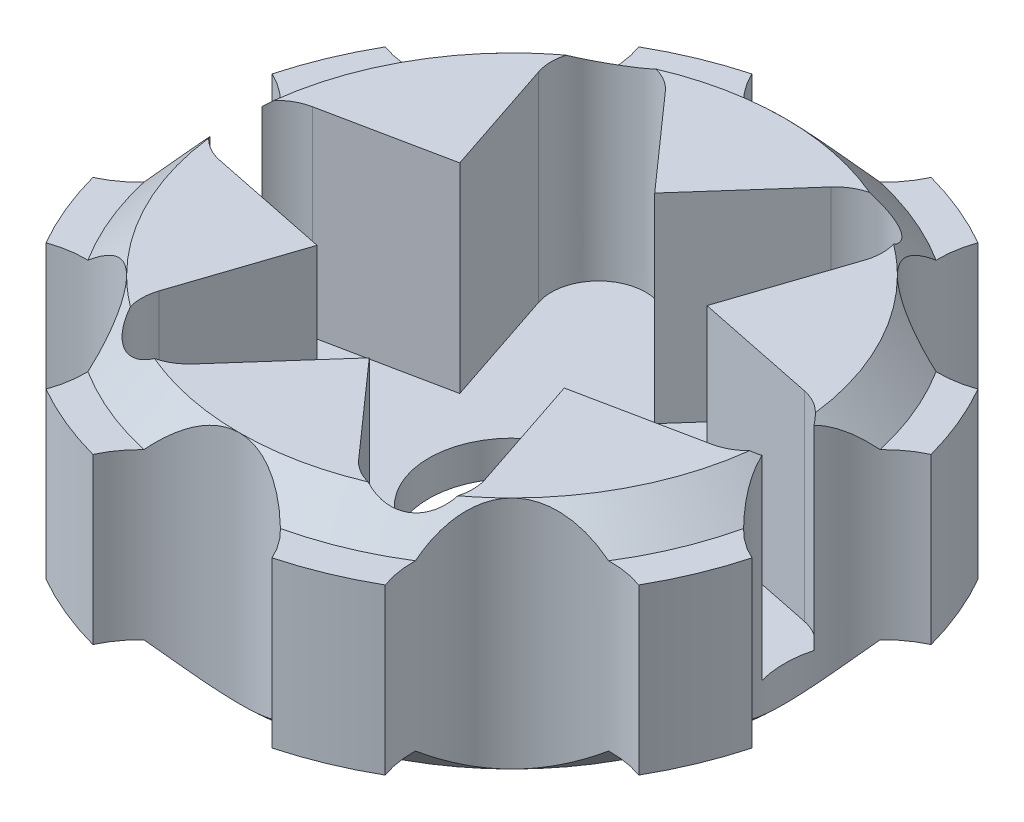
from build123d import *

# Parameters (mm, degrees)
SKETCH1_R           = 15.55551692
BOSS_EXTRUDE1_DEPTH = 9.4
BOSS_EXTRUDE2_START = 9.4
SKETCH1_4_R         = 15.55551692
BOSS_EXTRUDE2_DEPTH = 2
BOSS_EXTRUDE3_START = -2
SKETCH1_5_R         = 15.55551692
BOSS_EXTRUDE3_DEPTH = 2
CHAMFER2_SIZE       = 2
SKETCH3_R           = 6
SKETCH3_R_2         = 4.75
CUT_EXTRUDE4_DEPTH  = 11.4
SKETCH3_3_R         = 4.75
CUT_EXTRUDE5_DEPTH  = 30.783161882


with BuildPart() as part:
    # Sketch1 → Boss-Extrude1 (new body)
    with BuildSketch(Plane(origin=(0, 0, 0), x_dir=(1, 0, 0), z_dir=(0, 1, 0))):
        with BuildLine():
            ThreePointArc((-16.916819633, -9.681614935), (-13.766406033, -9.47966445), (-10.999411499, -10.999411499))
            ThreePointArc((-10.999411499, -10.999411499), (-14.371423694, -5.952838621), (-15.55551692, -3.1e-08))
            ThreePointArc((-15.55551692, -3.1e-08), (-16.437454083, -3.031184056), (-18.807933452, -5.116062305))
            ThreePointArc((-18.807933452, -5.116062305), (-18.007652913, -7.459014063), (-16.916819633, -9.681614935))
        make_face()
        with BuildLine():
            ThreePointArc((-5.116062305, -18.807933452), (-3.031184038, -16.437454071), (1.1e-08, -15.55551692))
            ThreePointArc((1.1e-08, -15.55551692), (-5.952838602, -14.371423702), (-10.999411499, -10.999411499))
            ThreePointArc((-10.999411499, -10.999411499), (-9.47966445, -13.766406033), (-9.681614935, -16.916819633))
            ThreePointArc((-9.681614935, -16.916819633), (-7.459014063, -18.007652913), (-5.116062305, -18.807933452))
        make_face()
        with BuildLine():
            ThreePointArc((1.1e-08, -15.55551692), (3.031184048, -16.437454078), (5.116062305, -18.807933452))
            ThreePointArc((5.116062305, -18.807933452), (7.459014063, -18.007652913), (9.681614935, -16.916819633))
            ThreePointArc((9.681614935, -16.916819633), (9.47966445, -13.766406033), (10.999411499, -10.999411499))
            ThreePointArc((10.999411499, -10.999411499), (5.952838612, -14.371423698), (1.1e-08, -15.55551692))
        make_face()
        Circle(SKETCH1_R)
        with BuildLine():
            ThreePointArc((15.55551692, 0), (14.3714237, -5.952838607), (10.999411499, -10.999411499))
            ThreePointArc((10.999411499, -10.999411499), (13.766406033, -9.47966445), (16.916819633, -9.681614935))
            ThreePointArc((16.916819633, -9.681614935), (18.007652913, -7.459014063), (18.807933452, -5.116062305))
            ThreePointArc((18.807933452, -5.116062305), (16.437454074, -3.031184043), (15.55551692, 0))
        make_face()
        with BuildLine():
            ThreePointArc((10.999411479, 10.999411519), (14.371423695, 5.95283862), (15.55551692, 0))
            ThreePointArc((15.55551692, 0), (16.437454074, 3.031184043), (18.807933452, 5.116062305))
            ThreePointArc((18.807933452, 5.116062305), (18.007652913, 7.459014063), (16.916819633, 9.681614935))
            ThreePointArc((16.916819633, 9.681614935), (13.76640602, 9.479664453), (10.999411479, 10.999411519))
        make_face()
        with BuildLine():
            ThreePointArc((-2e-09, 15.55551692), (5.952838593, 14.371423706), (10.999411479, 10.999411519))
            ThreePointArc((10.999411479, 10.999411519), (9.479664447, 13.766406047), (9.681614935, 16.916819633))
            ThreePointArc((9.681614935, 16.916819633), (7.459014063, 18.007652913), (5.116062305, 18.807933452))
            ThreePointArc((5.116062305, 18.807933452), (3.031184042, 16.437454074), (-2e-09, 15.55551692))
        make_face()
        with BuildLine():
            ThreePointArc((-9.681614935, 16.916819633), (-9.479664448, 13.766406042), (-10.999411487, 10.999411511))
            ThreePointArc((-10.999411487, 10.999411511), (-5.9528386, 14.371423703), (-2e-09, 15.55551692))
            ThreePointArc((-2e-09, 15.55551692), (-3.031184044, 16.437454075), (-5.116062305, 18.807933452))
            ThreePointArc((-5.116062305, 18.807933452), (-7.459014063, 18.007652913), (-9.681614935, 16.916819633))
        make_face()
        with BuildLine():
            ThreePointArc((-18.807933452, 5.116062305), (-16.437454066, 3.03118403), (-15.55551692, -3.1e-08))
            ThreePointArc((-15.55551692, -3.1e-08), (-14.371423703, 5.952838601), (-10.999411487, 10.999411511))
            ThreePointArc((-10.999411487, 10.999411511), (-13.766406025, 9.479664452), (-16.916819633, 9.681614935))
            ThreePointArc((-16.916819633, 9.681614935), (-18.007652913, 7.459014063), (-18.807933452, 5.116062305))
        make_face()
    extrude(amount=BOSS_EXTRUDE1_DEPTH)

    # Sketch1<4> → Boss-Extrude2 (add)
    with BuildSketch(Plane(origin=(0, 0, 0), x_dir=(1, 0, 0), z_dir=(0, 1, 0)).offset(BOSS_EXTRUDE2_START)):
        with Locations(Location((0, 0, 0), (0, 0, 270))):
            Circle(SKETCH1_4_R)
    extrude(amount=BOSS_EXTRUDE2_DEPTH)

    # Sketch1<5> → Boss-Extrude3 (add)
    with BuildSketch(Plane(origin=(0, 0, 0), x_dir=(1, 0, 0), z_dir=(0, 1, 0)).offset(BOSS_EXTRUDE3_START)):
        with Locations(Location((0, 0, 0), (0, 0, 270))):
            Circle(SKETCH1_5_R)
    extrude(amount=BOSS_EXTRUDE3_DEPTH)

    # Chamfer2
    # the kernel refuses this chamfer: 2 mm, written as the material it adds along each edge
    with BuildSketch(Plane(origin=(0, 9.4, 0), x_dir=(-0.7071067819532597, 0, 0.7071067804198353), z_dir=(-0.7071067804198353, 0, -0.7071067819532597))) as chamfer2_piece_1_section:
        Polygon((15.55551692, CHAMFER2_SIZE), (15.55551692 + CHAMFER2_SIZE, 0), (15.55551692, 0), align=None)
    chamfer2_piece_1 = revolve(axis=Axis((0, 9.4, 0), (0, 1, 0)), revolution_arc=45.000000062, mode=Mode.PRIVATE)
    chamfer2_piece_1 = chamfer2_piece_1 - Plane(origin=(-14.994564813, 10.103766753, 14.994564813), x_dir=(-0.3402220920568066, 0, -0.9403451111567975), z_dir=(0, -1, 0)) * Cylinder(5.65, 71, mode=Mode.PRIVATE)
    chamfer2_piece_1 = chamfer2_piece_1 - Plane(origin=(0, 10.103766753, 21.20551692), x_dir=(-0.9054977531574303, 0, -0.42435105635174936), z_dir=(0, -1, 0)) * Cylinder(5.65, 71, mode=Mode.PRIVATE)
    add(chamfer2_piece_1)
    with BuildSketch(Plane(origin=(0, 9.4, 0), x_dir=(-1.0, 0, 2.0490157005346928e-09), z_dir=(-2.0490157005346928e-09, 0, -1.0))) as chamfer2_piece_2_section:
        Polygon((15.55551692, CHAMFER2_SIZE), (15.55551692 + CHAMFER2_SIZE, 0), (15.55551692, 0), align=None)
    chamfer2_piece_2 = revolve(axis=Axis((0, 9.4, 0), (0, 1, 0)), revolution_arc=44.99999982, mode=Mode.PRIVATE)
    chamfer2_piece_2 = chamfer2_piece_2 - Plane(origin=(-21.20551692, 10.103766743, 0), x_dir=(1.0, 0, 5.4411098439037235e-09), z_dir=(0, -1, 0)) * Cylinder(5.65, 71, mode=Mode.PRIVATE)
    chamfer2_piece_2 = chamfer2_piece_2 - Plane(origin=(-14.994564813, 10.103766743, 14.994564813), x_dir=(-0.3402220920568066, 0, -0.9403451111567975), z_dir=(0, -1, 0)) * Cylinder(5.65, 71, mode=Mode.PRIVATE)
    add(chamfer2_piece_2)
    with BuildSketch(Plane(origin=(0, 9.4, 0), x_dir=(-0.7071067817625238, 0, -0.7071067806105713), z_dir=(0.7071067806105713, 0, -0.7071067817625238))) as chamfer2_piece_3_section:
        Polygon((15.55551692 + CHAMFER2_SIZE, 0), (15.55551692, CHAMFER2_SIZE), (15.55551692, 0), align=None)
    chamfer2_piece_3 = revolve(axis=Axis((0, 9.4, 0), (0, 1, 0)), revolution_arc=45.000000071, mode=Mode.PRIVATE)
    chamfer2_piece_3 = chamfer2_piece_3 - Plane(origin=(-14.994564813, 10.103766886, -14.994564813), x_dir=(0.9403451111567979, 0, -0.34022209205680554), z_dir=(0, -1, 0)) * Cylinder(5.65, 71, mode=Mode.PRIVATE)
    chamfer2_piece_3 = chamfer2_piece_3 - Plane(origin=(-21.20551692, 10.103766886, 0), x_dir=(1.0, 0, 5.4411098439037235e-09), z_dir=(0, -1, 0)) * Cylinder(5.65, 71, mode=Mode.PRIVATE)
    add(chamfer2_piece_3)
    with BuildSketch(Plane(origin=(0, 9.4, 0), x_dir=(1.1417875063861984e-10, 0, -1.0), z_dir=(1.0, 0, 1.1417875063861984e-10))) as chamfer2_piece_4_section:
        Polygon((15.55551692 + CHAMFER2_SIZE, 0), (15.55551692, CHAMFER2_SIZE), (15.55551692, 0), align=None)
    chamfer2_piece_4 = revolve(axis=Axis((0, 9.4, 0), (0, 1, 0)), revolution_arc=45.000000053, mode=Mode.PRIVATE)
    chamfer2_piece_4 = chamfer2_piece_4 - Plane(origin=(-14.994564813, 10.103766753, -14.994564813), x_dir=(0.9403451111567979, 0, -0.34022209205680554), z_dir=(0, -1, 0)) * Cylinder(5.65, 71, mode=Mode.PRIVATE)
    chamfer2_piece_4 = chamfer2_piece_4 - Plane(origin=(0, 10.103766753, -21.20551692), x_dir=(0.9054977531574306, 0, 0.4243510563517486), z_dir=(0, -1, 0)) * Cylinder(5.65, 71, mode=Mode.PRIVATE)
    add(chamfer2_piece_4)
    with BuildSketch(Plane(origin=(0, 9.4, 0), x_dir=(0.7071067822725222, 0, -0.7071067801005728), z_dir=(0.7071067801005728, 0, 0.7071067822725222))) as chamfer2_piece_5_section:
        Polygon((15.55551692, CHAMFER2_SIZE), (15.55551692 + CHAMFER2_SIZE, 0), (15.55551692, 0), align=None)
    chamfer2_piece_5 = revolve(axis=Axis((0, 9.4, 0), (0, 1, 0)), revolution_arc=45.000000081, mode=Mode.PRIVATE)
    chamfer2_piece_5 = chamfer2_piece_5 - Plane(origin=(0, 10.103766753, -21.20551692), x_dir=(0.9054977531574306, 0, 0.4243510563517486), z_dir=(0, -1, 0)) * Cylinder(5.65, 71, mode=Mode.PRIVATE)
    chamfer2_piece_5 = chamfer2_piece_5 - Plane(origin=(14.994564813, 10.103766753, -14.994564813), x_dir=(0.3402220920568063, 0, 0.9403451111567976), z_dir=(0, -1, 0)) * Cylinder(5.65, 71, mode=Mode.PRIVATE)
    add(chamfer2_piece_5)
    with BuildSketch(Plane(origin=(0, 9.4, 0), x_dir=(1.0, 0, 4.268254867465012e-10), z_dir=(-4.268254867465012e-10, 0, 1.0))) as chamfer2_piece_6_section:
        Polygon((15.55551692, CHAMFER2_SIZE), (15.55551692 + CHAMFER2_SIZE, 0), (15.55551692, 0), align=None)
    chamfer2_piece_6 = revolve(axis=Axis((0, 9.4, 0), (0, 1, 0)), revolution_arc=44.999999936, mode=Mode.PRIVATE)
    chamfer2_piece_6 = chamfer2_piece_6 - Plane(origin=(14.994564813, 10.103766753, -14.994564813), x_dir=(0.3402220920568063, 0, 0.9403451111567976), z_dir=(0, -1, 0)) * Cylinder(5.65, 71, mode=Mode.PRIVATE)
    chamfer2_piece_6 = chamfer2_piece_6 - Plane(origin=(21.20551692, 10.103766753, 0), x_dir=(-0.42435105635174664, 0, 0.9054977531574315), z_dir=(0, -1, 0)) * Cylinder(5.65, 71, mode=Mode.PRIVATE)
    add(chamfer2_piece_6)
    with BuildSketch(Plane(origin=(0, 9.4, 0), x_dir=(0.7071067799459831, 0, 0.7071067824271119), z_dir=(-0.7071067824271119, 0, 0.7071067799459831))) as chamfer2_piece_7_section:
        Polygon((15.55551692, CHAMFER2_SIZE), (15.55551692 + CHAMFER2_SIZE, 0), (15.55551692, 0), align=None)
    chamfer2_piece_7 = revolve(axis=Axis((0, 9.4, 0), (0, 1, 0)), revolution_arc=45.000000076, mode=Mode.PRIVATE)
    chamfer2_piece_7 = chamfer2_piece_7 - Plane(origin=(14.994564813, 10.103766753, 14.994564813), x_dir=(-0.9403451111567976, 0, 0.34022209205680604), z_dir=(0, -1, 0)) * Cylinder(5.65, 71, mode=Mode.PRIVATE)
    chamfer2_piece_7 = chamfer2_piece_7 - Plane(origin=(21.20551692, 10.103766753, 0), x_dir=(-0.42435105635174664, 0, 0.9054977531574315), z_dir=(0, -1, 0)) * Cylinder(5.65, 71, mode=Mode.PRIVATE)
    add(chamfer2_piece_7)
    with BuildSketch(Plane(origin=(0, 9.4, 0), x_dir=(0, 0, 1), z_dir=(-1, 0, 0))) as chamfer2_piece_8_section:
        Polygon((15.55551692, CHAMFER2_SIZE), (15.55551692 + CHAMFER2_SIZE, 0), (15.55551692, 0), align=None)
    chamfer2_piece_8 = revolve(axis=Axis((0, 9.4, 0), (0, 1, 0)), revolution_arc=44.999999899, mode=Mode.PRIVATE)
    chamfer2_piece_8 = chamfer2_piece_8 - Plane(origin=(14.994564813, 10.103766753, 14.994564813), x_dir=(-0.9403451111567976, 0, 0.34022209205680604), z_dir=(0, -1, 0)) * Cylinder(5.65, 71, mode=Mode.PRIVATE)
    chamfer2_piece_8 = chamfer2_piece_8 - Plane(origin=(0, 10.103766753, 21.20551692), x_dir=(-0.9054977531574303, 0, -0.42435105635174936), z_dir=(0, -1, 0)) * Cylinder(5.65, 71, mode=Mode.PRIVATE)
    add(chamfer2_piece_8)
    with BuildSketch(Plane(origin=(0, 0, 0), x_dir=(-0.7071067819532592, 0, 0.707106780419836), z_dir=(-0.707106780419836, 0, -0.7071067819532592))) as chamfer2_piece_9_section:
        Polygon((15.55551692, -CHAMFER2_SIZE), (15.55551692 + CHAMFER2_SIZE, 0), (15.55551692, 0), align=None)
    chamfer2_piece_9 = revolve(axis=Axis((0, 0, 0), (0, 1, 0)), revolution_arc=45.000000062, mode=Mode.PRIVATE)
    chamfer2_piece_9 = chamfer2_piece_9 - Plane(origin=(-14.994564813, -0.703766753, 14.994564813), x_dir=(-0.3402220920568066, 0, -0.9403451111567975), z_dir=(0, -1, 0)) * Cylinder(5.65, 71, mode=Mode.PRIVATE)
    chamfer2_piece_9 = chamfer2_piece_9 - Plane(origin=(0, -0.703766753, 21.20551692), x_dir=(-0.9054977531574303, 0, -0.42435105635174936), z_dir=(0, -1, 0)) * Cylinder(5.65, 71, mode=Mode.PRIVATE)
    add(chamfer2_piece_9)
    with BuildSketch(Plane(origin=(0, 0, 0), x_dir=(-1.0, 0, 7.725603147000415e-10), z_dir=(-7.725603147000415e-10, 0, -1.0))) as chamfer2_piece_10_section:
        Polygon((15.55551692, -CHAMFER2_SIZE), (15.55551692 + CHAMFER2_SIZE, 0), (15.55551692, 0), align=None)
    chamfer2_piece_10 = revolve(axis=Axis((0, 0, 0), (0, 1, 0)), revolution_arc=44.999999894, mode=Mode.PRIVATE)
    chamfer2_piece_10 = chamfer2_piece_10 - Plane(origin=(-21.20551692, -0.703766743, 0), x_dir=(1.0, 0, 5.4411098439037235e-09), z_dir=(0, -1, 0)) * Cylinder(5.65, 71, mode=Mode.PRIVATE)
    chamfer2_piece_10 = chamfer2_piece_10 - Plane(origin=(-14.994564813, -0.703766743, 14.994564813), x_dir=(-0.3402220920568066, 0, -0.9403451111567975), z_dir=(0, -1, 0)) * Cylinder(5.65, 71, mode=Mode.PRIVATE)
    add(chamfer2_piece_10)
    with BuildSketch(Plane(origin=(0, 0, 0), x_dir=(-0.7071067817031288, 0, -0.7071067806699662), z_dir=(0.7071067806699662, 0, -0.7071067817031288))) as chamfer2_piece_11_section:
        Polygon((15.55551692 + CHAMFER2_SIZE, 0), (15.55551692, -CHAMFER2_SIZE), (15.55551692, 0), align=None)
    chamfer2_piece_11 = revolve(axis=Axis((0, 0, 0), (0, 1, 0)), revolution_arc=45.000000002, mode=Mode.PRIVATE)
    chamfer2_piece_11 = chamfer2_piece_11 - Plane(origin=(-14.994564813, -0.703766886, -14.994564813), x_dir=(0.9403451111567979, 0, -0.34022209205680554), z_dir=(0, -1, 0)) * Cylinder(5.65, 71, mode=Mode.PRIVATE)
    chamfer2_piece_11 = chamfer2_piece_11 - Plane(origin=(-21.20551692, -0.703766886, 0), x_dir=(1.0, 0, 5.4411098439037235e-09), z_dir=(0, -1, 0)) * Cylinder(5.65, 71, mode=Mode.PRIVATE)
    add(chamfer2_piece_11)
    with BuildSketch(Plane(origin=(0, 0, 0), x_dir=(-5.915567194248534e-10, 0, -1.0), z_dir=(1.0, 0, -5.915567194248534e-10))) as chamfer2_piece_12_section:
        Polygon((15.55551692 + CHAMFER2_SIZE, 0), (15.55551692, -CHAMFER2_SIZE), (15.55551692, 0), align=None)
    chamfer2_piece_12 = revolve(axis=Axis((0, 0, 0), (0, 1, 0)), revolution_arc=45.000000008, mode=Mode.PRIVATE)
    chamfer2_piece_12 = chamfer2_piece_12 - Plane(origin=(-14.994564813, -0.703766753, -14.994564813), x_dir=(0.9403451111567979, 0, -0.34022209205680554), z_dir=(0, -1, 0)) * Cylinder(5.65, 71, mode=Mode.PRIVATE)
    chamfer2_piece_12 = chamfer2_piece_12 - Plane(origin=(0, -0.703766753, -21.20551692), x_dir=(0.9054977531574306, 0, 0.4243510563517486), z_dir=(0, -1, 0)) * Cylinder(5.65, 71, mode=Mode.PRIVATE)
    add(chamfer2_piece_12)
    with BuildSketch(Plane(origin=(0, 0, 0), x_dir=(0.7071067803065033, 0, -0.7071067820665917), z_dir=(0.7071067820665917, 0, 0.7071067803065033))) as chamfer2_piece_13_section:
        Polygon((15.55551692, -CHAMFER2_SIZE), (15.55551692 + CHAMFER2_SIZE, 0), (15.55551692, 0), align=None)
    chamfer2_piece_13 = revolve(axis=Axis((0, 0, 0), (0, 1, 0)), revolution_arc=44.999999963, mode=Mode.PRIVATE)
    chamfer2_piece_13 = chamfer2_piece_13 - Plane(origin=(0, -0.703766753, -21.20551692), x_dir=(0.9054977531574306, 0, 0.4243510563517486), z_dir=(0, -1, 0)) * Cylinder(5.65, 71, mode=Mode.PRIVATE)
    chamfer2_piece_13 = chamfer2_piece_13 - Plane(origin=(14.994564813, -0.703766753, -14.994564813), x_dir=(0.3402220920568063, 0, 0.9403451111567976), z_dir=(0, -1, 0)) * Cylinder(5.65, 71, mode=Mode.PRIVATE)
    add(chamfer2_piece_13)
    with BuildSketch(Plane(origin=(0, 0, 0), x_dir=(1.0, 0, 2.989517751270151e-10), z_dir=(-2.989517751270151e-10, 0, 1.0))) as chamfer2_piece_14_section:
        Polygon((15.55551692, -CHAMFER2_SIZE), (15.55551692 + CHAMFER2_SIZE, 0), (15.55551692, 0), align=None)
    chamfer2_piece_14 = revolve(axis=Axis((0, 0, 0), (0, 1, 0)), revolution_arc=45.000000088, mode=Mode.PRIVATE)
    chamfer2_piece_14 = chamfer2_piece_14 - Plane(origin=(14.994564813, -0.703766753, -14.994564813), x_dir=(0.3402220920568063, 0, 0.9403451111567976), z_dir=(0, -1, 0)) * Cylinder(5.65, 71, mode=Mode.PRIVATE)
    chamfer2_piece_14 = chamfer2_piece_14 - Plane(origin=(21.20551692, -0.703766753, 0), x_dir=(-0.42435105635174664, 0, 0.9054977531574315), z_dir=(0, -1, 0)) * Cylinder(5.65, 71, mode=Mode.PRIVATE)
    add(chamfer2_piece_14)
    with BuildSketch(Plane(origin=(0, 0, 0), x_dir=(0.7071067811865478, 0, 0.7071067811865472), z_dir=(-0.7071067811865472, 0, 0.7071067811865478))) as chamfer2_piece_15_section:
        Polygon((15.55551692, -CHAMFER2_SIZE), (15.55551692 + CHAMFER2_SIZE, 0), (15.55551692, 0), align=None)
    chamfer2_piece_15 = revolve(axis=Axis((0, 0, 0), (0, 1, 0)), revolution_arc=44.999999983, mode=Mode.PRIVATE)
    chamfer2_piece_15 = chamfer2_piece_15 - Plane(origin=(14.994564813, -0.703766753, 14.994564813), x_dir=(-0.9403451111567976, 0, 0.34022209205680604), z_dir=(0, -1, 0)) * Cylinder(5.65, 71, mode=Mode.PRIVATE)
    chamfer2_piece_15 = chamfer2_piece_15 - Plane(origin=(21.20551692, -0.703766753, 0), x_dir=(-0.42435105635174664, 0, 0.9054977531574315), z_dir=(0, -1, 0)) * Cylinder(5.65, 71, mode=Mode.PRIVATE)
    add(chamfer2_piece_15)
    with BuildSketch(Plane(origin=(0, 0, 0), x_dir=(0, 0, 1), z_dir=(-1, 0, 0))) as chamfer2_piece_16_section:
        Polygon((15.55551692, -CHAMFER2_SIZE), (15.55551692 + CHAMFER2_SIZE, 0), (15.55551692, 0), align=None)
    chamfer2_piece_16 = revolve(axis=Axis((0, 0, 0), (0, 1, 0)), revolution_arc=45, mode=Mode.PRIVATE)
    chamfer2_piece_16 = chamfer2_piece_16 - Plane(origin=(14.994564813, -0.703766753, 14.994564813), x_dir=(-0.9403451111567976, 0, 0.34022209205680604), z_dir=(0, -1, 0)) * Cylinder(5.65, 71, mode=Mode.PRIVATE)
    chamfer2_piece_16 = chamfer2_piece_16 - Plane(origin=(0, -0.703766753, 21.20551692), x_dir=(-0.9054977531574303, 0, -0.42435105635174936), z_dir=(0, -1, 0)) * Cylinder(5.65, 71, mode=Mode.PRIVATE)
    add(chamfer2_piece_16)

    # Sketch3 → Cut-Extrude4 (cut)
    with BuildSketch(Plane(origin=(0, 11.4, 0), x_dir=(1, 0, 0), z_dir=(0, 1, 0))):
        with BuildLine():
            Line((-9.121537298, -10.900260879), (-6.793934197, -3.922479738))
            Line((-6.793934197, -3.922479738), (-14.000671478, -2.449352582))
            ThreePointArc((-14.000671478, -2.449352582), (-14.823782137, -2.120754784), (-15.480522468, -1.525624709))
            ThreePointArc((-15.480522468, -1.525624709), (-15.46225454, -1.700820735), (-15.44200395, -1.875798672))
            ThreePointArc((-15.44200395, -1.875798672), (-14.799622784, -2.366639098), (-14.040725196, -2.645300789))
            Line((-14.040725196, -2.645300789), (-7.055057277, -4.073239218))
            Line((-7.055057277, -4.073239218), (-9.311260282, -10.836974313))
            ThreePointArc((-9.311260282, -10.836974313), (-9.449380972, -11.633529748), (-9.345491277, -12.43526837))
            ThreePointArc((-9.345491277, -12.43526837), (-9.204081234, -12.540294864), (-9.061490989, -12.643713367))
            ThreePointArc((-9.061490989, -12.643713367), (-9.248518587, -11.777394518), (-9.121537298, -10.900260879))
        make_face()
        with BuildLine():
            Line((-4.87913418, -13.349613461), (0, -7.844959475))
            Line((0, -7.844959475), (-1.912800834, -5.686931771))
            ThreePointArc((-1.912800834, -5.686931771), (-3, -5.196152423), (-3.968626967, -4.5))
            Line((-3.968626967, -4.5), (-6.793934197, -3.922479738))
            Line((-6.793934197, -3.922479738), (-9.121537298, -10.900260879))
            ThreePointArc((-9.121537298, -10.900260879), (-9.248518587, -11.777394518), (-9.061490989, -12.643713367))
            ThreePointArc((-9.061490989, -12.643713367), (-7.77775846, -13.471472822), (-6.41903148, -14.169338076))
            ThreePointArc((-6.41903148, -14.169338076), (-5.57526355, -13.898149303), (-4.87913418, -13.349613461))
        make_face()
        with BuildLine():
            ThreePointArc((-6.096512672, -14.311067042), (-6.258173306, -14.241115599), (-6.41903148, -14.169338076))
            ThreePointArc((-6.41903148, -14.169338076), (-8, -13.856406461), (-9.061490989, -12.643713367))
            ThreePointArc((-9.061490989, -12.643713367), (-9.204081234, -12.540294864), (-9.345491277, -12.43526837))
            ThreePointArc((-9.345491277, -12.43526837), (-8.1, -14.029611541), (-6.096512672, -14.311067042))
        make_face()
        with BuildLine():
            Line((4.87913418, -13.349613461), (0, -7.844959475))
            Line((0, -7.844959475), (-4.87913418, -13.349613461))
            ThreePointArc((-4.87913418, -13.349613461), (-5.57526355, -13.898149303), (-6.41903148, -14.169338076))
            ThreePointArc((-6.41903148, -14.169338076), (-6.258173306, -14.241115599), (-6.096512672, -14.311067042))
            ThreePointArc((-6.096512672, -14.311067042), (-5.350241811, -14.000168846), (-4.729464914, -13.482275101))
            Line((-4.729464914, -13.482275101), (0, -8.146478436))
            Line((0, -8.146478436), (4.729464914, -13.482275101))
            ThreePointArc((4.729464914, -13.482275101), (5.350241811, -14.000168846), (6.096512672, -14.311067042))
            ThreePointArc((6.096512672, -14.311067042), (6.258173306, -14.241115599), (6.41903148, -14.169338076))
            ThreePointArc((6.41903148, -14.169338076), (5.57526355, -13.898149303), (4.87913418, -13.349613461))
        make_face()
        with BuildLine():
            Line((6.793934197, -3.922479738), (3.968626967, -4.5))
            ThreePointArc((3.968626967, -4.5), (3, -5.196152423), (1.912800834, -5.686931771))
            Line((1.912800834, -5.686931771), (0, -7.844959475))
            Line((0, -7.844959475), (4.87913418, -13.349613461))
            ThreePointArc((4.87913418, -13.349613461), (5.57526355, -13.898149303), (6.41903148, -14.169338076))
            ThreePointArc((6.41903148, -14.169338076), (7.77775846, -13.471472822), (9.061490989, -12.643713367))
            ThreePointArc((9.061490989, -12.643713367), (9.248518587, -11.777394518), (9.121537298, -10.900260879))
            Line((9.121537298, -10.900260879), (6.793934197, -3.922479738))
        make_face()
        with BuildLine():
            ThreePointArc((9.345491277, -12.43526837), (9.204081234, -12.540294864), (9.061490989, -12.643713367))
            ThreePointArc((9.061490989, -12.643713367), (8, -13.856406461), (6.41903148, -14.169338076))
            ThreePointArc((6.41903148, -14.169338076), (6.258173306, -14.241115599), (6.096512672, -14.311067042))
            ThreePointArc((6.096512672, -14.311067042), (8.1, -14.029611541), (9.345491277, -12.43526837))
        make_face()
        with BuildLine():
            Line((14.000671478, -2.449352582), (6.793934197, -3.922479738))
            Line((6.793934197, -3.922479738), (9.121537298, -10.900260879))
            ThreePointArc((9.121537298, -10.900260879), (9.248518587, -11.777394518), (9.061490989, -12.643713367))
            ThreePointArc((9.061490989, -12.643713367), (9.204081234, -12.540294864), (9.345491277, -12.43526837))
            ThreePointArc((9.345491277, -12.43526837), (9.449380972, -11.633529748), (9.311260282, -10.836974313))
            Line((9.311260282, -10.836974313), (7.055057277, -4.073239218))
            Line((7.055057277, -4.073239218), (14.040725196, -2.645300789))
            ThreePointArc((14.040725196, -2.645300789), (14.799622784, -2.366639098), (15.44200395, -1.875798672))
            ThreePointArc((15.44200395, -1.875798672), (15.46225454, -1.700820735), (15.480522468, -1.525624709))
            ThreePointArc((15.480522468, -1.525624709), (14.823782137, -2.120754784), (14.000671478, -2.449352582))
        make_face()
        with BuildLine():
            ThreePointArc((6.41903148, -14.169338076), (8, -13.856406461), (9.061490989, -12.643713367))
            ThreePointArc((9.061490989, -12.643713367), (7.77775846, -13.471472822), (6.41903148, -14.169338076))
        make_face()
        with BuildLine():
            ThreePointArc((15.480522468, 1.525624709), (16, 0), (15.480522468, -1.525624709))
            ThreePointArc((15.480522468, -1.525624709), (15.46225454, -1.700820735), (15.44200395, -1.875798672))
            ThreePointArc((15.44200395, -1.875798672), (16.2, 0), (15.44200395, 1.875798672))
            ThreePointArc((15.44200395, 1.875798672), (15.46225454, 1.700820735), (15.480522468, 1.525624709))
        make_face()
        with BuildLine():
            Line((5.8814278, -1.186931771), (6.793934197, -3.922479738))
            Line((6.793934197, -3.922479738), (14.000671478, -2.449352582))
            ThreePointArc((14.000671478, -2.449352582), (14.823782137, -2.120754784), (15.480522468, -1.525624709))
            ThreePointArc((15.480522468, -1.525624709), (15.536756995, -0.763733416), (15.55551692, 0))
            ThreePointArc((15.55551692, 0), (15.536756995, 0.763733416), (15.480522468, 1.525624709))
            ThreePointArc((15.480522468, 1.525624709), (14.823782137, 2.120754784), (14.000671478, 2.449352582))
            Line((14.000671478, 2.449352582), (6.793934197, 3.922479738))
            Line((6.793934197, 3.922479738), (5.8814278, 1.186931771))
            ThreePointArc((5.8814278, 1.186931771), (5.97028336, 0.596419818), (6, 0))
            ThreePointArc((6, 0), (5.97028336, -0.596419818), (5.8814278, -1.186931771))
        make_face()
        with BuildLine():
            ThreePointArc((15.55551692, 0), (15.536756995, -0.763733416), (15.480522468, -1.525624709))
            ThreePointArc((15.480522468, -1.525624709), (16, 0), (15.480522468, 1.525624709))
            ThreePointArc((15.480522468, 1.525624709), (15.536756995, 0.763733416), (15.55551692, 0))
        make_face()
        with BuildLine():
            ThreePointArc((14.000671478, 2.449352582), (14.823782137, 2.120754784), (15.480522468, 1.525624709))
            ThreePointArc((15.480522468, 1.525624709), (15.46225454, 1.700820735), (15.44200395, 1.875798672))
            ThreePointArc((15.44200395, 1.875798672), (14.799622784, 2.366639098), (14.040725196, 2.645300789))
            Line((14.040725196, 2.645300789), (7.055057277, 4.073239218))
            Line((7.055057277, 4.073239218), (9.311260282, 10.836974313))
            ThreePointArc((9.311260282, 10.836974313), (9.449380972, 11.633529748), (9.345491277, 12.43526837))
            ThreePointArc((9.345491277, 12.43526837), (9.204081234, 12.540294864), (9.061490989, 12.643713367))
            ThreePointArc((9.061490989, 12.643713367), (9.248518587, 11.777394518), (9.121537298, 10.900260879))
            Line((9.121537298, 10.900260879), (6.793934197, 3.922479738))
            Line((6.793934197, 3.922479738), (14.000671478, 2.449352582))
        make_face()
        with BuildLine():
            Line((-4.87913418, 13.349613461), (0, 7.844959475))
            Line((0, 7.844959475), (4.87913418, 13.349613461))
            ThreePointArc((4.87913418, 13.349613461), (5.57526355, 13.898149303), (6.41903148, 14.169338076))
            ThreePointArc((6.41903148, 14.169338076), (6.258173306, 14.241115599), (6.096512672, 14.311067042))
            ThreePointArc((6.096512672, 14.311067042), (5.350241811, 14.000168846), (4.729464914, 13.482275101))
            Line((4.729464914, 13.482275101), (0, 8.146478436))
            Line((0, 8.146478436), (-4.729464914, 13.482275101))
            ThreePointArc((-4.729464914, 13.482275101), (-5.350241811, 14.000168846), (-6.096512672, 14.311067042))
            ThreePointArc((-6.096512672, 14.311067042), (-6.258173306, 14.241115599), (-6.41903148, 14.169338076))
            ThreePointArc((-6.41903148, 14.169338076), (-5.57526355, 13.898149303), (-4.87913418, 13.349613461))
        make_face()
        with BuildLine():
            ThreePointArc((6.41903148, 14.169338076), (8, 13.856406461), (9.061490989, 12.643713367))
            ThreePointArc((9.061490989, 12.643713367), (9.204081234, 12.540294864), (9.345491277, 12.43526837))
            ThreePointArc((9.345491277, 12.43526837), (8.1, 14.029611541), (6.096512672, 14.311067042))
            ThreePointArc((6.096512672, 14.311067042), (6.258173306, 14.241115599), (6.41903148, 14.169338076))
        make_face()
        with BuildLine():
            Line((3.968626967, 4.5), (6.793934197, 3.922479738))
            Line((6.793934197, 3.922479738), (9.121537298, 10.900260879))
            ThreePointArc((9.121537298, 10.900260879), (9.248518587, 11.777394518), (9.061490989, 12.643713367))
            ThreePointArc((9.061490989, 12.643713367), (7.77775846, 13.471472822), (6.41903148, 14.169338076))
            ThreePointArc((6.41903148, 14.169338076), (5.57526355, 13.898149303), (4.87913418, 13.349613461))
            Line((4.87913418, 13.349613461), (0, 7.844959475))
            Line((0, 7.844959475), (1.912800834, 5.686931771))
            ThreePointArc((1.912800834, 5.686931771), (3, 5.196152423), (3.968626967, 4.5))
        make_face()
        with BuildLine():
            ThreePointArc((6.41903148, 14.169338076), (7.77775846, 13.471472822), (9.061490989, 12.643713367))
            ThreePointArc((9.061490989, 12.643713367), (8, 13.856406461), (6.41903148, 14.169338076))
        make_face()
        with BuildLine():
            Line((-9.121537298, 10.900260879), (-6.793934197, 3.922479738))
            Line((-6.793934197, 3.922479738), (-3.968626967, 4.5))
            ThreePointArc((-3.968626967, 4.5), (-3, 5.196152423), (-1.912800834, 5.686931771))
            Line((-1.912800834, 5.686931771), (0, 7.844959475))
            Line((0, 7.844959475), (-4.87913418, 13.349613461))
            ThreePointArc((-4.87913418, 13.349613461), (-5.57526355, 13.898149303), (-6.41903148, 14.169338076))
            ThreePointArc((-6.41903148, 14.169338076), (-7.77775846, 13.471472822), (-9.061490989, 12.643713367))
            ThreePointArc((-9.061490989, 12.643713367), (-9.248518587, 11.777394518), (-9.121537298, 10.900260879))
        make_face()
        with BuildLine():
            ThreePointArc((-9.345491277, 12.43526837), (-9.204081234, 12.540294864), (-9.061490989, 12.643713367))
            ThreePointArc((-9.061490989, 12.643713367), (-8, 13.856406461), (-6.41903148, 14.169338076))
            ThreePointArc((-6.41903148, 14.169338076), (-6.258173306, 14.241115599), (-6.096512672, 14.311067042))
            ThreePointArc((-6.096512672, 14.311067042), (-8.1, 14.029611541), (-9.345491277, 12.43526837))
        make_face()
        with BuildLine():
            ThreePointArc((-6.41903148, 14.169338076), (-8, 13.856406461), (-9.061490989, 12.643713367))
            ThreePointArc((-9.061490989, 12.643713367), (-7.77775846, 13.471472822), (-6.41903148, 14.169338076))
        make_face()
        with BuildLine():
            Line((-14.000671478, 2.449352582), (-6.793934197, 3.922479738))
            Line((-6.793934197, 3.922479738), (-9.121537298, 10.900260879))
            ThreePointArc((-9.121537298, 10.900260879), (-9.248518587, 11.777394518), (-9.061490989, 12.643713367))
            ThreePointArc((-9.061490989, 12.643713367), (-9.204081234, 12.540294864), (-9.345491277, 12.43526837))
            ThreePointArc((-9.345491277, 12.43526837), (-9.449380972, 11.633529748), (-9.311260282, 10.836974313))
            Line((-9.311260282, 10.836974313), (-7.055057277, 4.073239218))
            Line((-7.055057277, 4.073239218), (-14.040725196, 2.645300789))
            ThreePointArc((-14.040725196, 2.645300789), (-14.799622784, 2.366639098), (-15.44200395, 1.875798672))
            ThreePointArc((-15.44200395, 1.875798672), (-15.46225454, 1.700820735), (-15.480522468, 1.525624709))
            ThreePointArc((-15.480522468, 1.525624709), (-14.823782137, 2.120754784), (-14.000671478, 2.449352582))
        make_face()
        with BuildLine():
            Line((-14.000671478, -2.449352582), (-6.793934197, -3.922479738))
            Line((-6.793934197, -3.922479738), (-5.8814278, -1.186931771))
            ThreePointArc((-5.8814278, -1.186931771), (-6, 0), (-5.8814278, 1.186931771))
            Line((-5.8814278, 1.186931771), (-6.793934197, 3.922479738))
            Line((-6.793934197, 3.922479738), (-14.000671478, 2.449352582))
            ThreePointArc((-14.000671478, 2.449352582), (-14.823782137, 2.120754784), (-15.480522468, 1.525624709))
            ThreePointArc((-15.480522468, 1.525624709), (-15.536756995, 0.763733416), (-15.55551692, 0))
            ThreePointArc((-15.55551692, 0), (-15.536756995, -0.763733416), (-15.480522468, -1.525624709))
            ThreePointArc((-15.480522468, -1.525624709), (-14.823782137, -2.120754784), (-14.000671478, -2.449352582))
        make_face()
        with BuildLine():
            ThreePointArc((-15.480522468, 1.525624709), (-16, 0), (-15.480522468, -1.525624709))
            ThreePointArc((-15.480522468, -1.525624709), (-15.536756995, -0.763733416), (-15.55551692, 0))
            ThreePointArc((-15.55551692, 0), (-15.536756995, 0.763733416), (-15.480522468, 1.525624709))
        make_face()
        with BuildLine():
            ThreePointArc((-15.44200395, -1.875798672), (-15.46225454, -1.700820735), (-15.480522468, -1.525624709))
            ThreePointArc((-15.480522468, -1.525624709), (-16, 0), (-15.480522468, 1.525624709))
            ThreePointArc((-15.480522468, 1.525624709), (-15.46225454, 1.700820735), (-15.44200395, 1.875798672))
            ThreePointArc((-15.44200395, 1.875798672), (-16.2, 0), (-15.44200395, -1.875798672))
        make_face()
        Circle(SKETCH3_R)
        with BuildLine():
            Line((-6.793934197, -3.922479738), (-3.968626967, -4.5))
            ThreePointArc((-3.968626967, -4.5), (-5.196152423, -3), (-5.8814278, -1.186931771))
            Line((-5.8814278, -1.186931771), (-6.793934197, -3.922479738))
        make_face()
        with BuildLine():
            Line((-6.793934197, 3.922479738), (-5.8814278, 1.186931771))
            ThreePointArc((-5.8814278, 1.186931771), (-5.196152423, 3), (-3.968626967, 4.5))
            Line((-3.968626967, 4.5), (-6.793934197, 3.922479738))
        make_face()
        with BuildLine():
            ThreePointArc((-1.912800834, 5.686931771), (0, 6), (1.912800834, 5.686931771))
            Line((1.912800834, 5.686931771), (0, 7.844959475))
            Line((0, 7.844959475), (-1.912800834, 5.686931771))
        make_face()
        with BuildLine():
            ThreePointArc((3.968626967, 4.5), (5.196152423, 3), (5.8814278, 1.186931771))
            Line((5.8814278, 1.186931771), (6.793934197, 3.922479738))
            Line((6.793934197, 3.922479738), (3.968626967, 4.5))
        make_face()
        with BuildLine():
            ThreePointArc((5.8814278, -1.186931771), (5.196152423, -3), (3.968626967, -4.5))
            Line((3.968626967, -4.5), (6.793934197, -3.922479738))
            Line((6.793934197, -3.922479738), (5.8814278, -1.186931771))
        make_face()
        with BuildLine():
            Line((0, -7.844959475), (1.912800834, -5.686931771))
            ThreePointArc((1.912800834, -5.686931771), (0, -6), (-1.912800834, -5.686931771))
            Line((-1.912800834, -5.686931771), (0, -7.844959475))
        make_face()
        with BuildLine():
            ThreePointArc((-9.061490989, -12.643713367), (-8, -13.856406461), (-6.41903148, -14.169338076))
            ThreePointArc((-6.41903148, -14.169338076), (-7.77775846, -13.471472822), (-9.061490989, -12.643713367))
        make_face()
        Circle(SKETCH3_R_2)
    extrude(amount=-CUT_EXTRUDE4_DEPTH, mode=Mode.SUBTRACT)

    # Sketch3<3> → Cut-Extrude5 (cut, through all)
    with BuildSketch(Plane(origin=(0, 11.4, 0), x_dir=(1, 0, 0), z_dir=(0, 1, 0))):
        with Locations(Location((0, 0, 0), (0, 0, 270))):
            Circle(SKETCH3_3_R)
    extrude(amount=-CUT_EXTRUDE5_DEPTH, mode=Mode.SUBTRACT)


solid = part.part
